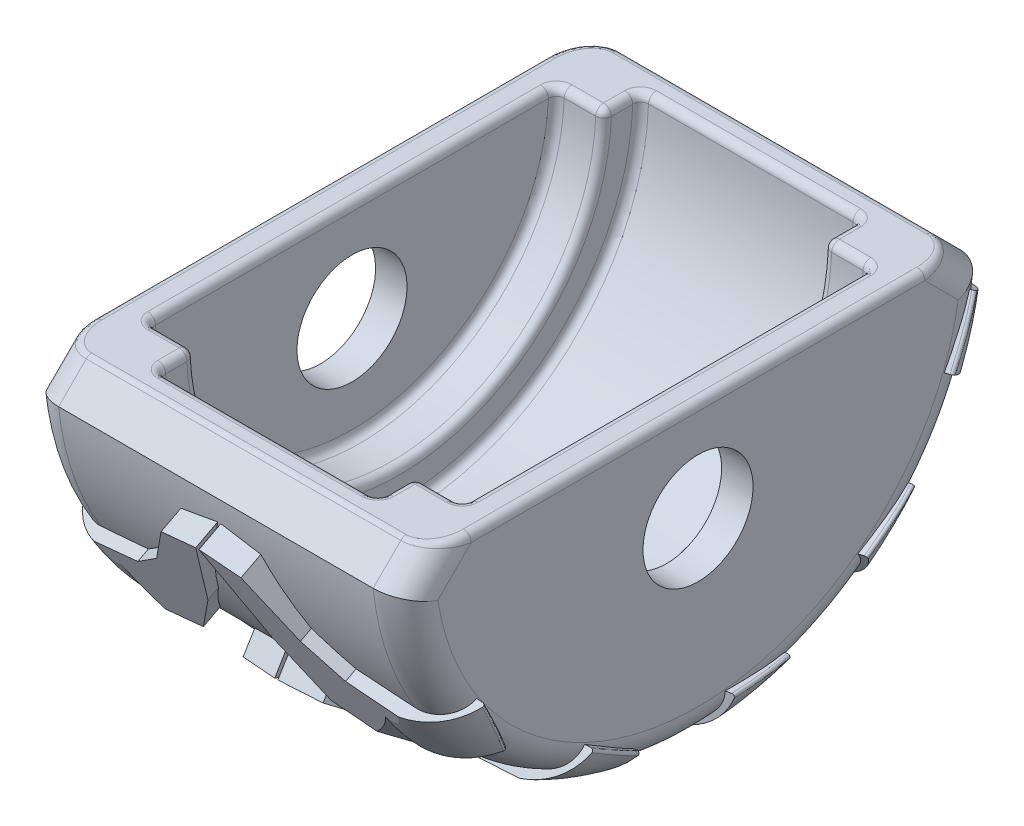
from build123d import *

# Parameters (mm, degrees)
BOSS_EXTRUDE1_DEPTH             = 20
SKETCH2_W                       = 3
SKETCH2_H                       = 2.3571
REVOLVE1_ANGLE                  = 180
SKETCH3_R                       = 3.5
BOSS_EXTRUDE2_DEPTH             = 2
BOSS_EXTRUDE3_START             = 2
SKETCH4_R                       = 3.5
BOSS_EXTRUDE3_DEPTH             = 2
CHAMFER1_SIZE                   = 2
FILLET1_START                   = -16
FILLET1_2_DEPTH                 = 7
FILLET1_3_DEPTH                 = 7
FILLET2_R                       = 0.5
BOSS_EXTRUDE4_START             = -2
BOSS_EXTRUDE4_DEPTH             = 2.75
CIRPATTERN1_COUNT               = 3
CIRPATTERN1_ANGLE               = 62.5
CIRPATTERN1_THE_OTHER_WAY_COUNT = 3
CIRPATTERN1_THE_OTHER_WAY_ANGLE = 62.5
FILLET3_R                       = 0.15


with BuildPart() as part:
    # Sketch1 → Boss-Extrude1 (new body)
    with BuildSketch(Plane(origin=(0, 0, 0), x_dir=(0, 0, -1), z_dir=(1, 0, 0))):
        with BuildLine():
            Line((-18.75, 0), (-15.3571, 0))
            ThreePointArc((-15.3571, 0), (0, -15.3571), (15.3571, 0))
            Line((15.3571, 0), (18.75, 0))
            ThreePointArc((18.75, 0), (0, -18.75), (-18.75, 0))
        make_face()
    extrude(amount=BOSS_EXTRUDE1_DEPTH)

    # Sketch2 → Revolve1 (revolve)
    with BuildSketch(Plane(origin=(0, 0, 0), x_dir=(1, 0, 0), z_dir=(0, 1, 0))):
        with Locations((1.5, -14.17855)):
            Rectangle(SKETCH2_W, SKETCH2_H)
        with Locations((18.5, -14.17855)):
            Rectangle(SKETCH2_W, SKETCH2_H)
    revolve(axis=Axis((0, 0, 0), (1, 0, 0)), revolution_arc=REVOLVE1_ANGLE)

    # Sketch3 → Boss-Extrude2 (add)
    with BuildSketch(Plane(origin=(20, 0, 0), x_dir=(0, 0, -1), z_dir=(1, 0, 0))):
        with BuildLine():
            Line((-18.75, 0), (18.75, 0))
            ThreePointArc((18.75, 0), (0, -18.75), (-18.75, 0))
        make_face()
        with Locations((0, -6.3693)):
            Circle(SKETCH3_R, mode=Mode.SUBTRACT)
    extrude(amount=BOSS_EXTRUDE2_DEPTH)

    # Sketch4 → Boss-Extrude3 (add)
    with BuildSketch(Plane.ZY.offset(BOSS_EXTRUDE3_START)):
        with BuildLine():
            Line((-18.75, 0), (18.75, 0))
            ThreePointArc((18.75, 0), (0, -18.75), (-18.75, 0))
        make_face()
        with Locations(Location((0, -6.3693, 0), (0, 0, 180))):
            Circle(SKETCH4_R, mode=Mode.SUBTRACT)
    extrude(amount=-BOSS_EXTRUDE3_DEPTH)

    # Chamfer1
    # the kernel refuses this chamfer: 2 mm, written as the material it takes off along each edge
    with BuildSketch(Plane(origin=(27.143365976, 0, -18.75), x_dir=(0, 0, 1), z_dir=(-1, 0, 0)), Plane(origin=(-7.143365976, 0, 18.75), x_dir=(0, 0, -1), z_dir=(1, 0, 0))) as chamfer1_piece_1:
        with BuildLine():
            Line((CHAMFER1_SIZE, 0), (0.09683747, -1.90316253))
            ThreePointArc((0.09683747, -1.90316253), (0.025606166, -0.979579281), (0, 0))
            Line((0, 0), (CHAMFER1_SIZE, 0))
        make_face()
    extrude(amount=34.286731952, mode=Mode.SUBTRACT)

    # Fillet1: read off the stored shape, not the designer's step
    # Fillet1 outline → Fillet1 (revolve, cut)
    with BuildSketch(Plane.YX):
        with BuildLine():
            ThreePointArc((16.75, 22), (18.164213562, 21.414213562), (18.75, 20))
            Line((18.75, 20), (18.75, 22))
            Line((18.75, 22), (16.75, 22))
        make_face()
        with BuildLine():
            Line((18.75, -2), (18.75, 0))
            ThreePointArc((18.75, 0), (18.164213562, -1.414213562), (16.75, -2))
            Line((16.75, -2), (18.75, -2))
        make_face()
    revolve(axis=Axis((0, 0, 0), (1, 0, 0)), mode=Mode.SUBTRACT)

    # Fillet1 2 outline → Fillet1 2 (cut)
    with BuildSketch(Plane(origin=(0, 0, 0), x_dir=(1, 0, 0), z_dir=(0, 0.707106781186549, 0.707106781186546)).offset(FILLET1_START)):
        with BuildLine():
            Line((22, 11.844038585), (20, 11.844038585))
            ThreePointArc((20, 11.844038585), (21.414213562, 11.258252147), (22, 9.844038585))
            Line((22, 9.844038585), (22, 11.844038585))
        make_face()
        with BuildLine():
            ThreePointArc((-2, 9.844038585), (-1.414213562, 11.258252147), (0, 11.844038585))
            Line((0, 11.844038585), (-2, 11.844038585))
            Line((-2, 11.844038585), (-2, 9.844038585))
        make_face()
    extrude(amount=FILLET1_2_DEPTH, mode=Mode.SUBTRACT)

    # Fillet1 3 outline → Fillet1 3 (cut)
    with BuildSketch(Plane(origin=(0, 0, 0), x_dir=(1, 0, 0), z_dir=(0, 0.707106781186547, -0.707106781186548)).offset(FILLET1_START)):
        with BuildLine():
            Line((-2, -11.844038585), (0, -11.844038585))
            ThreePointArc((0, -11.844038585), (-1.414213562, -11.258252147), (-2, -9.844038585))
            Line((-2, -9.844038585), (-2, -11.844038585))
        make_face()
        with BuildLine():
            ThreePointArc((22, -9.844038585), (21.414213562, -11.258252147), (20, -11.844038585))
            Line((20, -11.844038585), (22, -11.844038585))
            Line((22, -11.844038585), (22, -9.844038585))
        make_face()
    extrude(amount=FILLET1_3_DEPTH, mode=Mode.SUBTRACT)

    # Fillet2
    fillet2_edges = [part.edges().sort_by_distance(p)[0] for p in [
        (1.5, 0, -13),
        (0, -13, 0),
        (3, 0, -14.17855),
        (3, -13, 0),
        (3, -15.3571, 0),
        (3, 0, 14.17855),
        (1.5, 0, 13),
        (10, 0, -15.3571),
        (10, 0, 15.3571),
        (20, -13, 0),
        (17, -13, 0),
        (18.5, 0, -13),
        (17, -15.3571, 0),
        (17, 0, -14.17855),
        (18.5, 0, 13),
        (17, 0, 14.17855),
        (20, 0, 0),
        (0, 0, 0),
        (22, 0, 0),
        (10, 0, 16.75),
        (10, 0, -16.75),
        (-2, 0, 0),
        (21.526592033, 0, -15.748875129),
        (-1.526592033, 0, -15.748875129),
        (-1.526592033, 0, 15.748875129),
        (21.526592033, 0, 15.748875129),
    ]]
    fillet(fillet2_edges, radius=FILLET2_R)

    # Sketch5 → Boss-Extrude4 (add)
    with BuildSketch(Plane(origin=(0, -18.75, 0), x_dir=(-1, 0, 0), z_dir=(0, -1, 0)).offset(BOSS_EXTRUDE4_START)):
        Polygon((-22.7, 5.943136501), (-22.7, 1.879136501), (-16.604, 0.610231502), (-14.572, -1.203934718), (-12.54, -4.987004679), (-10.1016, -5.494566679), (-12.032, 0.362451125), (-14.064, 4.145521086), align=None)
        Polygon((-5.936, 4.145521086), (-7.968, 0.362451125), (-9.8984, -5.494566679), (-7.46, -4.987004679), (-5.428, -1.203934718), (-3.396, 0.610231502), (2.7, 1.879136501), (2.7, 5.943136501), align=None)
    boss_extrude4 = extrude(amount=BOSS_EXTRUDE4_DEPTH)

    # CirPattern1: Boss-Extrude4 ×3 about axis
    cirpattern1_axis = Axis((0, 0, 0), (-1, 0, 0))
    for i in range(1, CIRPATTERN1_COUNT):
        add(boss_extrude4.rotate(cirpattern1_axis, i * CIRPATTERN1_ANGLE / (CIRPATTERN1_COUNT - 1)))

    # CirPattern1 the other way: Boss-Extrude4 ×3 about axis
    cirpattern1_the_other_way_axis = Axis((0, 0, 0), (1, 0, 0))
    for i in range(1, CIRPATTERN1_THE_OTHER_WAY_COUNT):
        add(boss_extrude4.rotate(cirpattern1_the_other_way_axis, i * CIRPATTERN1_THE_OTHER_WAY_ANGLE / (CIRPATTERN1_THE_OTHER_WAY_COUNT - 1)))

    # Sketch7 → Cut-Revolve4 (revolve, cut)
    with BuildSketch(Plane(origin=(0, 0, 0), x_dir=(-1, 0, 0), z_dir=(0, -1, 0))):
        with BuildLine():
            Line((-13.873614206, 20.800500036), (-18.403971652, 19.62803487))
            ThreePointArc((-18.403971652, 19.62803487), (-21.41563341, 18.627214332), (-22.7, 15.725120129))
            Line((-22.7, 15.725120129), (-23.345318059, 15.725120129))
            Line((-23.345318059, 15.725120129), (-23.345318059, 20.635530377))
            Line((-23.345318059, 20.635530377), (-13.873614206, 20.800500036))
        make_face()
        with BuildLine():
            Line((3.345318059, 20.635530377), (-6.126385794, 20.800500036))
            Line((-6.126385794, 20.800500036), (-1.596028348, 19.62803487))
            ThreePointArc((-1.596028348, 19.62803487), (1.41563341, 18.627214332), (2.7, 15.725120129))
            Line((2.7, 15.725120129), (3.345318059, 15.725120129))
            Line((3.345318059, 15.725120129), (3.345318059, 20.635530377))
        make_face()
    revolve(axis=Axis((0, 0, 0), (1, 0, 0)), mode=Mode.SUBTRACT)

    # Fillet3
    fillet3_edges = [part.edges().sort_by_distance(p)[0] for p in [
        (-2.417899639, -4.324478506, -16.632466589),
        (22.417899639, -4.324478506, -16.632466589),
        (22.417899639, -16.314020775, 5.403034827),
        (22.417899639, -11.144100037, 13.082396322),
        (22.417899639, -12.325526893, -11.975869321),
        (22.417899639, -16.75, -3.844159099),
        (-2.417899639, -16.75, -3.844159099),
        (-2.417899639, -16.314020775, 5.403034827),
        (-2.417899639, -11.144100037, 13.082396322),
        (-2.417899639, -12.325526893, -11.975869321),
    ]]
    fillet(fillet3_edges, radius=FILLET3_R)


solid = part.part
